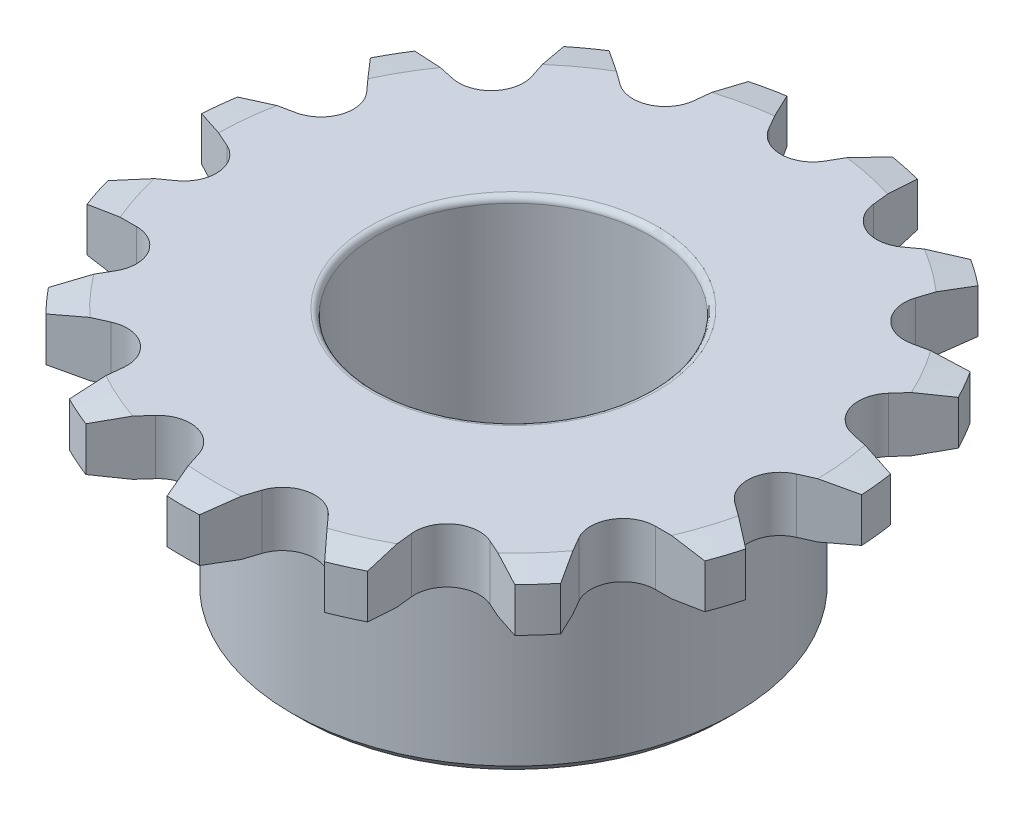
from build123d import *

# Parameters (mm, degrees)
CUT_EXTRUDE1_REACH = 28.993
CIRPATTERN1_START  = -2.794
CIRPATTERN1_DEPTH  = 2.794
SKETCH3_R          = 4
CUT_EXTRUDE2_DEPTH = 27.976562092
SKETCH4_R          = 7
CUT_EXTRUDE3_DEPTH = 14
FILLET1_R          = 0.3


# Read off the part's stored shape, not the designer's step: CirPattern1
with BuildPart() as part:
    # Sketch1 → Revolve2 (revolve)
    with BuildSketch(Plane.XY, mode=Mode.PRIVATE) as revolve2_sk:
        Polygon((0, 0), (15.270906545, 0), (16.842200598, -0.277061536), (16.842200598, -2.516938464), (15.270906545, -2.794), (11.3109375, -2.794), (11.3109375, -12.2), (10.8109375, -12.7), (0, -12.7), align=None)
    revolve(revolve2_sk.sketch.rotate(Axis((0, 0, 0), (0, -1, 0)), 180), axis=Axis((0, 0, 0), (0, -1, 0)))

    # Cut-Extrude1: up to this face of the body (flat: up to its plane)
    cut_extrude1_end = Plane(part.part.faces().sort_by_distance((14.838980082, -2.794, 0))[0])
    # Sketch2 → Cut-Extrude1 (cut, up to the picked face)
    with BuildSketch(Plane(origin=(0, 0, 0), x_dir=(1, 0, 0), z_dir=(0, 1, 0)), mode=Mode.PRIVATE) as cut_extrude1_sk1:
        with BuildLine():
            Line((1.428941916, 14.445906545), (2.687818706, 16.626345106))
            ThreePointArc((2.687818706, 16.626345106), (0, 16.842200598), (-2.687818706, 16.626345106))
            Line((-2.687818706, 16.626345106), (-1.428941916, 14.445906545))
            ThreePointArc((-1.428941916, 14.445906545), (0, 13.620906545), (1.428941916, 14.445906545))
        make_face()
    cut_extrude1_tool1 = split(extrude(cut_extrude1_sk1.sketch, amount=-CUT_EXTRUDE1_REACH, mode=Mode.PRIVATE), bisect_by=cut_extrude1_end, keep=Keep.BOTH, mode=Mode.PRIVATE)
    add(cut_extrude1_tool1.solids().sort_by(Axis((0, 0, -15.494128), (0, -1, 0)))[0], mode=Mode.SUBTRACT)

    # CirPattern1 outline → CirPattern1 (cut)
    with BuildSketch(Plane(origin=(0, 0, 0), x_dir=(1, 0, 0), z_dir=(0, 1, 0)).offset(CIRPATTERN1_START)):
        with BuildLine():
            ThreePointArc((-15.742746587, -5.985453272), (-14.585773574, -8.421100299), (-13.054927881, -10.640891834))
            Line((-13.054927881, -10.640891834), (-11.79605109, -8.460453272))
            ThreePointArc((-11.79605109, -8.460453272), (-11.79605109, -6.810453272), (-13.224993006, -5.985453272))
            Line((-13.224993006, -5.985453272), (-15.742746587, -5.985453272))
        make_face()
        with BuildLine():
            ThreePointArc((-4.307099225, 16.282156406), (-6.850340133, 15.386115853), (-9.217988365, 14.095687691))
            Line((-9.217988365, 14.095687691), (-7.181082931, 12.615789267))
            ThreePointArc((-7.181082931, 12.615789267), (-5.540121804, 12.443317303), (-4.570276137, 13.778195343))
            Line((-4.570276137, 13.778195343), (-4.307099225, 16.282156406))
        make_face()
        with BuildLine():
            ThreePointArc((-10.557280571, 13.122634946), (-12.516194224, 11.269631899), (-14.154284093, 9.127757819))
            Line((-14.154284093, 9.127757819), (-11.691549469, 8.604287415))
            ThreePointArc((-11.691549469, 8.604287415), (-10.122306217, 9.114165455), (-9.779251927, 10.728108997))
            Line((-9.779251927, 10.728108997), (-10.557280571, 13.122634946))
        make_face()
        with BuildLine():
            ThreePointArc((-14.982012197, 7.694090687), (-16.017884627, 5.204526207), (-16.643175513, 2.581555697))
            Line((-16.643175513, 2.581555697), (-14.180440889, 3.105026101))
            ThreePointArc((-14.180440889, 3.105026101), (-12.954251927, 4.209091601), (-13.297306217, 5.823035142))
            Line((-13.297306217, 5.823035142), (-14.982012197, 7.694090687))
        make_face()
        with BuildLine():
            ThreePointArc((-16.816217807, 0.935168251), (-16.749937261, -1.760489346), (-16.254310689, -4.411020858))
            Line((-16.254310689, -4.411020858), (-14.217405254, -2.931122435))
            ThreePointArc((-14.217405254, -2.931122435), (-13.546289793, -1.42377243), (-14.51613546, -0.088894389))
            Line((-14.51613546, -0.088894389), (-16.816217807, 0.935168251))
        make_face()
        with BuildLine():
            Line((7.181082931, 12.615789267), (9.217988365, 14.095687691))
            ThreePointArc((9.217988365, 14.095687691), (6.850340133, 15.386115853), (4.307099225, 16.282156406))
            Line((4.307099225, 16.282156406), (4.570276137, 13.778195343))
            ThreePointArc((4.570276137, 13.778195343), (5.540121804, 12.443317303), (7.181082931, 12.615789267))
        make_face()
        with BuildLine():
            Line((11.691549469, 8.604287415), (14.154284093, 9.127757819))
            ThreePointArc((14.154284093, 9.127757819), (12.516194224, 11.269631899), (10.557280571, 13.122634946))
            Line((10.557280571, 13.122634946), (9.779251927, 10.728108997))
            ThreePointArc((9.779251927, 10.728108997), (10.122306217, 9.114165455), (11.691549469, 8.604287415))
        make_face()
        with BuildLine():
            Line((14.180440889, 3.105026101), (16.643175513, 2.581555697))
            ThreePointArc((16.643175513, 2.581555697), (16.017884627, 5.204526207), (14.982012197, 7.694090687))
            Line((14.982012197, 7.694090687), (13.297306217, 5.823035142))
            ThreePointArc((13.297306217, 5.823035142), (12.954251927, 4.209091601), (14.180440889, 3.105026101))
        make_face()
        with BuildLine():
            Line((14.217405254, -2.931122435), (16.254310689, -4.411020858))
            ThreePointArc((16.254310689, -4.411020858), (16.749937261, -1.760489346), (16.816217807, 0.935168251))
            Line((16.816217807, 0.935168251), (14.51613546, -0.088894389))
            ThreePointArc((14.51613546, -0.088894389), (13.546289793, -1.42377243), (14.217405254, -2.931122435))
        make_face()
        with BuildLine():
            Line((11.79605109, -8.460453272), (13.054927881, -10.640891834))
            ThreePointArc((13.054927881, -10.640891834), (14.585773574, -8.421100299), (15.742746587, -5.985453272))
            Line((15.742746587, -5.985453272), (13.224993006, -5.985453272))
            ThreePointArc((13.224993006, -5.985453272), (11.79605109, -6.810453272), (11.79605109, -8.460453272))
        make_face()
        with BuildLine():
            Line((7.335052529, -12.526894878), (7.598229441, -15.030855942))
            ThreePointArc((7.598229441, -15.030855942), (9.899597128, -13.625626506), (11.947211464, -11.871135548))
            Line((11.947211464, -11.871135548), (9.647129117, -10.847072909))
            ThreePointArc((9.647129117, -10.847072909), (8.00616799, -11.019544873), (7.335052529, -12.526894878))
        make_face()
        with BuildLine():
            Line((1.605756748, -14.427322557), (0.827728104, -16.821848506))
            ThreePointArc((0.827728104, -16.821848506), (3.501690403, -16.474158106), (6.085894942, -15.704190642))
            Line((6.085894942, -15.704190642), (4.401188962, -13.833135097))
            ThreePointArc((4.401188962, -13.833135097), (2.83194571, -13.323257056), (1.605756748, -14.427322557))
        make_face()
        with BuildLine():
            Line((-4.401188962, -13.833135097), (-6.085894942, -15.704190642))
            ThreePointArc((-6.085894942, -15.704190642), (-3.501690403, -16.474158106), (-0.827728104, -16.821848506))
            Line((-0.827728104, -16.821848506), (-1.605756748, -14.427322557))
            ThreePointArc((-1.605756748, -14.427322557), (-2.83194571, -13.323257056), (-4.401188962, -13.833135097))
        make_face()
        with BuildLine():
            Line((-9.647129117, -10.847072909), (-11.947211464, -11.871135548))
            ThreePointArc((-11.947211464, -11.871135548), (-9.899597128, -13.625626506), (-7.598229441, -15.030855942))
            Line((-7.598229441, -15.030855942), (-7.335052529, -12.526894878))
            ThreePointArc((-7.335052529, -12.526894878), (-8.00616799, -11.019544873), (-9.647129117, -10.847072909))
        make_face()
    extrude(amount=CIRPATTERN1_DEPTH, mode=Mode.SUBTRACT)

    # Sketch3 → Cut-Extrude2 (cut, through all)
    with BuildSketch(Plane.XZ.offset(12.7)):
        Circle(SKETCH3_R)
    extrude(amount=-CUT_EXTRUDE2_DEPTH, mode=Mode.SUBTRACT)

    # Sketch4 → Cut-Extrude3 (cut)
    with BuildSketch(Plane.XZ.offset(12.7)):
        Circle(SKETCH4_R)
    extrude(amount=-CUT_EXTRUDE3_DEPTH, mode=Mode.SUBTRACT)

    # Fillet1
    fillet1_edges = [part.edges().sort_by_distance(p)[0] for p in [
        (-7, 0, 0),
        (-7, -12.7, 0),
    ]]
    fillet(fillet1_edges, radius=FILLET1_R)


solid = part.part
